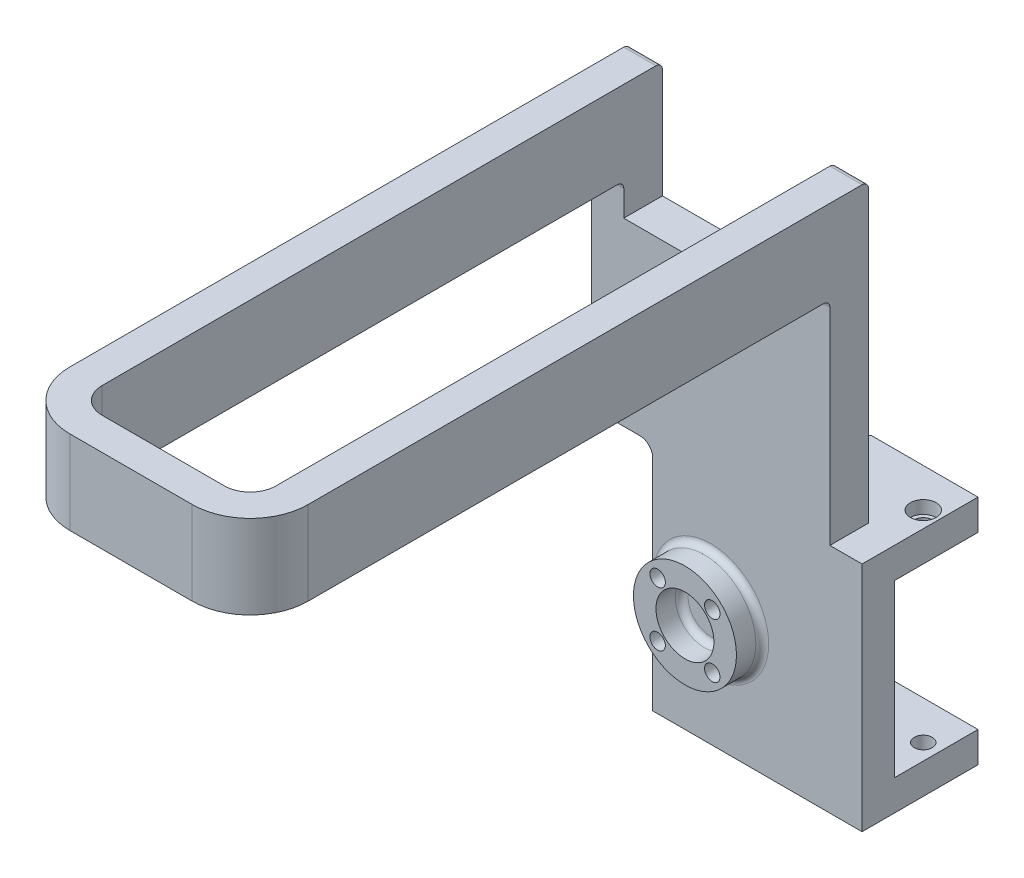
from build123d import *

# Parameters (mm, degrees)
SKETCH_1_W                   = 32.5
SKETCH_1_H                   = 36
EXTRUDE_1_DEPTH              = 18
SKETCH_2_W                   = 13
SKETCH_2_H                   = 26.5
CUT_EXTRUDE_1_DEPTH          = 42.282562905
HOLE_WIZARD_M2_3_AT_2_COUNT  = 2
HOLE_WIZARD_M2_3_AT_2_PITCH  = 21
CUT_EXTRUDE_3_DEPTH          = 40.555340979
CUT_EXTRUDE_3_DEPTH_BACK     = 40.555340979
SKETCH_4_R                   = 8.25
SKETCH_4_R_2                 = 1.2
SKETCH_18_R                  = 8
EXTRUDE_4_DEPTH              = 4
HOLE_WIZARD_M2_2_D           = 2.4
HOLE_WIZARD_M2_2_CBORE_D     = 4.2
HOLE_WIZARD_M2_2_CBORE_DEPTH = 1.45
SKETCH_19_R                  = 4.5
CUT_EXTRUDE_9_DEPTH          = 4
SKETCH_13_W                  = 37
SKETCH_13_H                  = 6
EXTRUDE_3_DEPTH              = 33
EXTRUDE_5_DEPTH              = 13
FILLET_1_R                   = 1
FILLET_2_R                   = 1
FILLET_3_R                   = 2
FILLET_4_R                   = 1
SKETCH_21_W                  = 27
SKETCH_21_H                  = 6
CUT_EXTRUDE_10_DEPTH         = 5


with BuildPart() as part:
    # ｽｹｯﾁ1 → ﾎﾞｽ - 押し出し1 (new body)
    with BuildSketch(Plane.XY):
        Rectangle(SKETCH_1_W, SKETCH_1_H)
    extrude(amount=EXTRUDE_1_DEPTH)

    # ｽｹｯﾁ2 → ｶｯﾄ - 押し出し1 (cut, through all)
    with BuildSketch(Plane(origin=(16.25, 0, 0), x_dir=(0, 0, -1), z_dir=(1, 0, 0))):
        with Locations((-6.5, 0)):
            Rectangle(SKETCH_2_W, SKETCH_2_H)
    extrude(amount=-CUT_EXTRUDE_1_DEPTH, mode=Mode.SUBTRACT)

    # ｽｹｯﾁ6 → M2 丸平ねじ用座ぐり穴3 (revolve, cut)
    with BuildSketch(Plane(origin=(13.75, 18, 6), x_dir=(0, 0, 1), z_dir=(1, 0, 0))):
        Polygon((0, 0), (0, 5.591204867), (1.4, 4.75), (1.4, 2), (2, 2), (2, 0), align=None)
    hole_wizard_m2_3 = revolve(axis=Axis((13.75, 24.35, 6), (0, -1, 0)), mode=Mode.SUBTRACT)

    # M2 丸平ねじ用座ぐり穴3 at 2: M2 丸平ねじ用座ぐり穴3 ×2
    with Locations(*[(-i * HOLE_WIZARD_M2_3_AT_2_PITCH, 0, 0) for i in range(1, HOLE_WIZARD_M2_3_AT_2_COUNT)]):
        add(hole_wizard_m2_3, mode=Mode.SUBTRACT)

    # ﾐﾗｰ1: M2 丸平ねじ用座ぐり穴3 across plane
    add(hole_wizard_m2_3.mirror(Plane.ZX), mode=Mode.SUBTRACT)

    # ﾐﾗｰ1 copy 1 sketch → ﾐﾗｰ1 copy 1 (revolve, cut)
    with BuildSketch(Plane(origin=(-7.25, -18, 6), x_dir=(0, 0, 1), z_dir=(1, 0, 0))):
        Polygon((0, 0), (0, -5.591204867), (1.4, -4.75), (1.4, -2), (2, -2), (2, 0), align=None)
    revolve(axis=Axis((-7.25, -24.35, 6), (0, -1, 0)), mode=Mode.SUBTRACT)

    # ｽｹｯﾁ4 → ｶｯﾄ - 押し出し3 (cut, two sides: drawn at the far end of the back side and taken through both)
    with BuildSketch(Plane.XZ.offset(-13.25).offset(-CUT_EXTRUDE_3_DEPTH_BACK)):
        with Locations((-7.25, -4.5)):
            Circle(SKETCH_4_R)
        with Locations((-7.25, 6)):
            Circle(SKETCH_4_R_2)
    extrude(amount=CUT_EXTRUDE_3_DEPTH + CUT_EXTRUDE_3_DEPTH_BACK, mode=Mode.SUBTRACT)

    # ｽｹｯﾁ18 → ﾎﾞｽ - 押し出し4 (add)
    with BuildSketch(Plane.XY.offset(18)):
        with Locations((-7.25, 0)):
            Circle(SKETCH_18_R)
    extrude(amount=EXTRUDE_4_DEPTH)

    # M2 丸平ねじ用座ぐり穴2 (through all)
    with Locations(Plane(origin=(0, 0, 13), x_dir=(-1, 0, 0), z_dir=(0, 0, -1))):
        with Locations((11.492640687, 4.242640687), (3.007359313, -4.242640687), (11.492640687, -4.242640687), (3.007359313, 4.242640687)):
            CounterBoreHole(HOLE_WIZARD_M2_2_D / 2, HOLE_WIZARD_M2_2_CBORE_D / 2, HOLE_WIZARD_M2_2_CBORE_DEPTH)

    # ｽｹｯﾁ19 → ｶｯﾄ - 押し出し9 (cut)
    with BuildSketch(Plane.XY.offset(22)):
        with Locations((-7.25, 0)):
            Circle(SKETCH_19_R)
    extrude(amount=-CUT_EXTRUDE_9_DEPTH, mode=Mode.SUBTRACT)

    # ｽｹｯﾁ13 → ﾎﾞｽ - 押し出し3 (add)
    with BuildSketch(Plane(origin=(0, 18, 0), x_dir=(1, 0, 0), z_dir=(0, 1, 0))):
        with Locations((-7.25, -15)):
            Rectangle(SKETCH_13_W, SKETCH_13_H)
    extrude(amount=EXTRUDE_3_DEPTH)

    # ｽｹｯﾁ20 → ﾎﾞｽ - 押し出し5 (add)
    with BuildSketch(Plane(origin=(0, 51, 0), x_dir=(1, 0, 0), z_dir=(0, 1, 0))):
        with BuildLine():
            Line((11.25, -12), (11.25, -99))
            ThreePointArc((11.25, -99), (8.613961031, -105.363961031), (2.25, -108))
            Line((2.25, -108), (-16.75, -108))
            ThreePointArc((-16.75, -108), (-23.113961031, -105.363961031), (-25.75, -99))
            Line((-25.75, -99), (-25.75, -12))
            Line((-25.75, -12), (-20.75, -12))
            Line((-20.75, -12), (-20.75, -99))
            ThreePointArc((-20.75, -99), (-19.578427125, -101.828427125), (-16.75, -103))
            Line((-16.75, -103), (2.25, -103))
            ThreePointArc((2.25, -103), (5.078427125, -101.828427125), (6.25, -99))
            Line((6.25, -99), (6.25, -12))
            Line((6.25, -12), (11.25, -12))
        make_face()
    extrude(amount=EXTRUDE_5_DEPTH)

    # ﾌｨﾚｯﾄ1
    fillet_1_edges = [part.edges().sort_by_distance(p)[0] for p in [
        (-23.25, 51, 18),
        (8.75, 51, 18),
    ]]
    fillet(fillet_1_edges, radius=FILLET_1_R)

    # ﾌｨﾚｯﾄ2
    fillet_2_edges = [part.edges().sort_by_distance(p)[0] for p in [
        (8.75, 64, 12),
        (-23.25, 64, 12),
    ]]
    fillet(fillet_2_edges, radius=FILLET_2_R)

    # ﾌｨﾚｯﾄ3
    fillet_3_edges = [part.edges().sort_by_distance(p)[0] for p in [
        (-16.25, 18, 15),
    ]]
    fillet(fillet_3_edges, radius=FILLET_3_R)

    # ﾌｨﾚｯﾄ4
    fillet_4_edges = [part.edges().sort_by_distance(p)[0] for p in [
        (-11.75, 0, 18),
        (-15.25, 0, 18),
    ]]
    fillet(fillet_4_edges, radius=FILLET_4_R - 0.0001)  # a hair under: the kernel refuses the full size

    # ｽｹｯﾁ21 → ｶｯﾄ - 押し出し10 (cut)
    with BuildSketch(Plane(origin=(0, 51, 0), x_dir=(1, 0, 0), z_dir=(0, 1, 0))):
        with Locations((-7.25, -15)):
            Rectangle(SKETCH_21_W, SKETCH_21_H)
    extrude(amount=-CUT_EXTRUDE_10_DEPTH, mode=Mode.SUBTRACT)


solid = part.part
